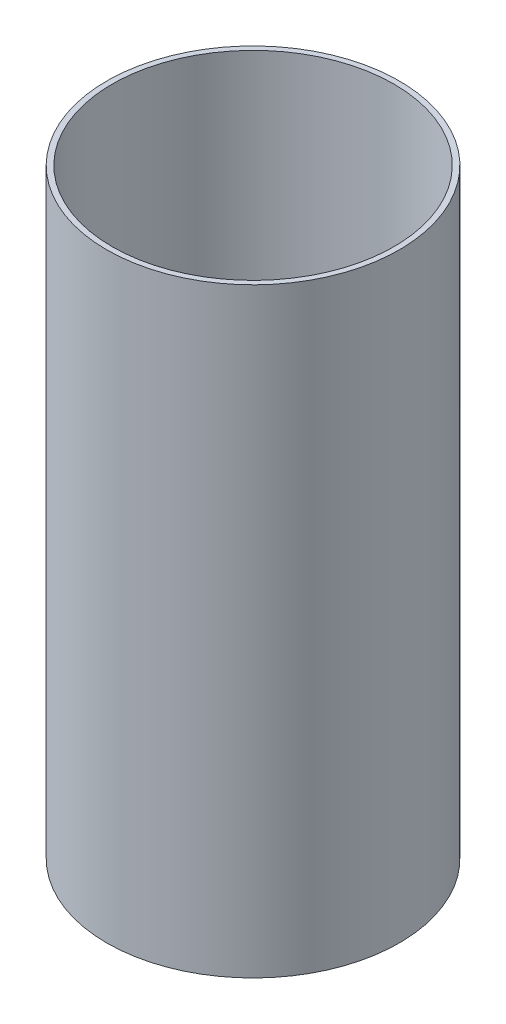
from build123d import *

# Parameters (mm, degrees)
SKETCH1_R           = 49.5173
SKETCH1_R_2         = 47.6885
BOSS_EXTRUDE1_DEPTH = 203.2


with BuildPart() as part:
    # Sketch1 → Boss-Extrude1 (new body)
    with BuildSketch(Plane(origin=(0, 0, 0), x_dir=(1, 0, 0), z_dir=(0, 1, 0))):
        Circle(SKETCH1_R)
        Circle(SKETCH1_R_2, mode=Mode.SUBTRACT)
    extrude(amount=BOSS_EXTRUDE1_DEPTH)


solid = part.part
